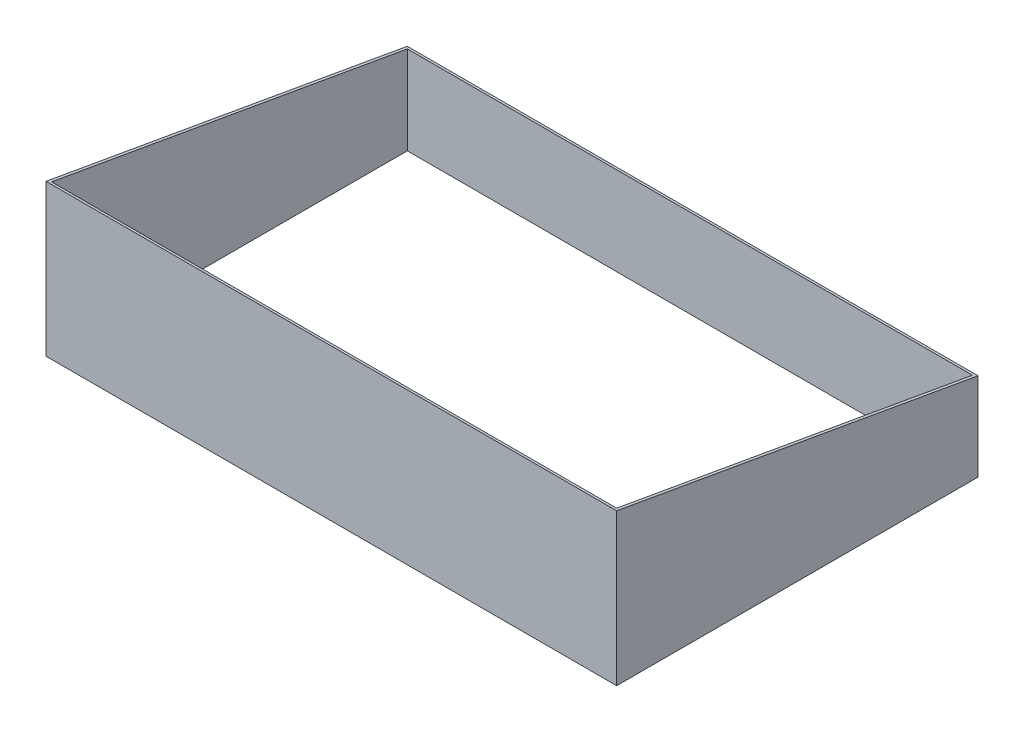
from build123d import *

# Parameters (mm, degrees)
BOSS_EXTRUDE1_DEPTH = 1300
SHELL1_T            = -6.35


with BuildPart() as part:
    # Sketch1 → Boss-Extrude1 (new body)
    with BuildSketch(Plane(origin=(0, 0, 0), x_dir=(0, 0, -1), z_dir=(1, 0, 0))):
        Polygon((0, 345.126464485), (0, 0), (823.05307958, 0), (823.05307958, 200), align=None)
    extrude(amount=BOSS_EXTRUDE1_DEPTH)

    # Shell1
    shell1_openings = [part.faces().sort_by_distance(p)[0] for p in [
        (650, 0, -411.52653979),
        (650, 272.563232243, -411.52653979),
    ]]
    offset(amount=SHELL1_T, openings=shell1_openings, kind=Kind.INTERSECTION)


solid = part.part
